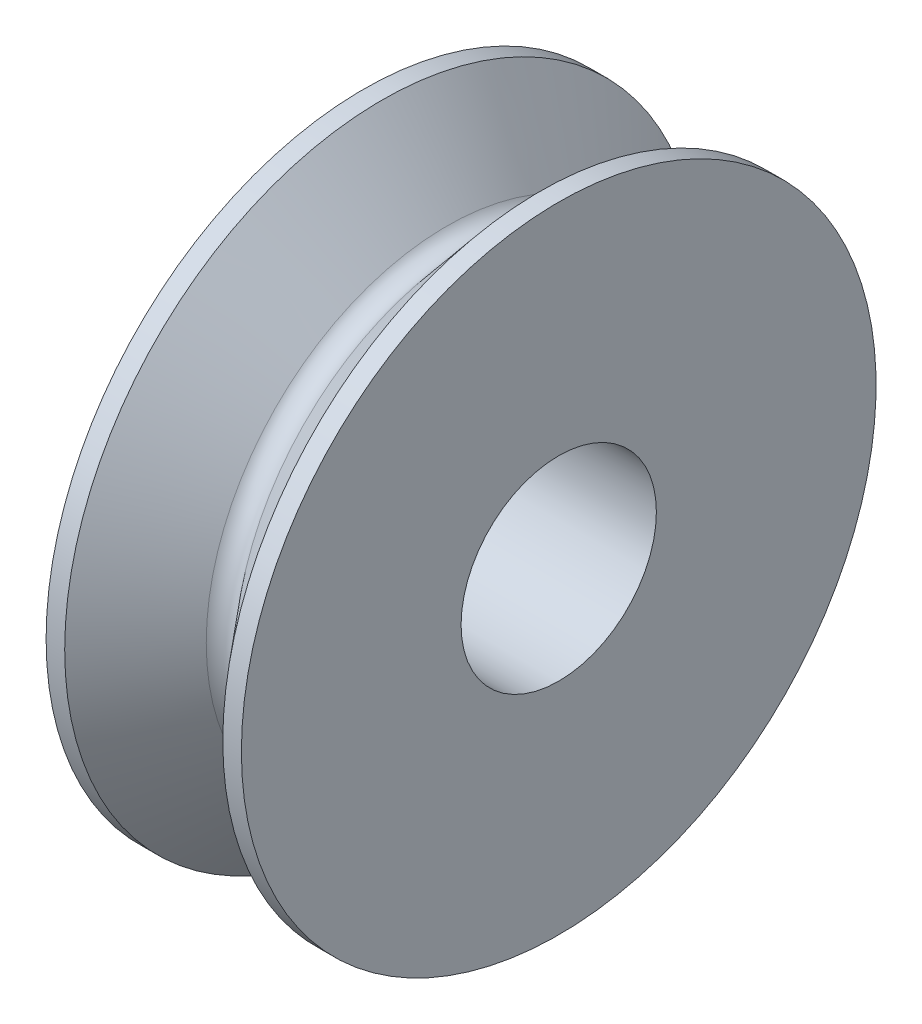
from build123d import *


with BuildPart() as part:
    # Sketch1 → Revolve1 (revolve)
    with BuildSketch(Plane.XY):
        with BuildLine():
            Line((0, 0), (4, 0))
            Line((4, 0), (4, 4.5))
            Line((4, 4.5), (3.619, 4.5))
            Line((3.619, 4.5), (2.290963922, 2.929030498))
            ThreePointArc((2.290963922, 2.929030498), (2, 2.794), (1.709036078, 2.929030498))
            Line((1.709036078, 2.929030498), (0.381, 4.5))
            Line((0.381, 4.5), (0, 4.5))
            Line((0, 4.5), (0, 0))
        make_face()
    revolve(axis=Axis((0, -2, 0), (1, 0, 0)))


solid = part.part
